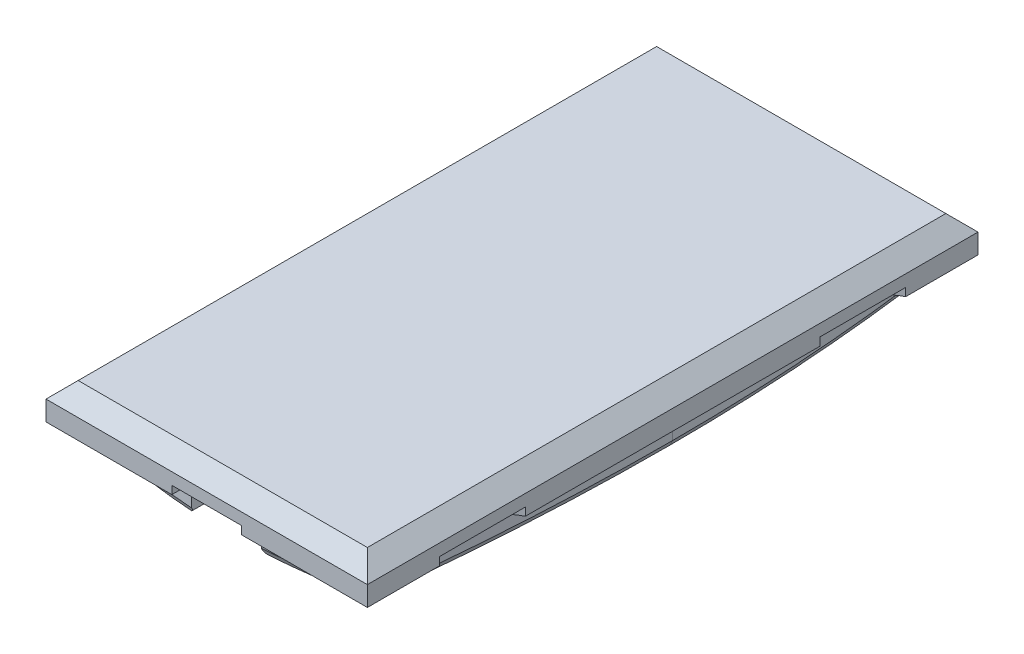
from build123d import *
from OCP.BRepFilletAPI import BRepFilletAPI_MakeChamfer

# Parameters (mm, degrees)
SKETCH1_W           = 60
SKETCH1_H           = 114
BOSS_EXTRUDE1_DEPTH = 11.7
CHAMFER1_SIZE       = 3
SKETCH2_W           = 60
SKETCH2_H           = 114
CUT_EXTRUDE1_DEPTH  = 5
SKETCH3_W           = 13
SKETCH3_H           = 18
CUT_EXTRUDE2_DEPTH  = 1.5
SKETCH4_W           = 45
SKETCH4_H           = 61
CUT_EXTRUDE3_DEPTH  = 3
SKETCH5_W           = 38
SKETCH5_H           = 40
CUT_EXTRUDE4_DEPTH  = 3
FILLET1_R           = 3.5
FILLET2_R           = 2.5
FILLET3_R           = 2
CHAMFER2_SIZE       = 1
CHAMFER2_SIZE2      = 0.5
CHAMFER3_SIZE       = 0.5
SKETCH6_R           = 1.5
CUT_EXTRUDE5_DEPTH  = 3.5
CUT_EXTRUDE6_DEPTH  = 1.5


with BuildPart() as part:
    # Sketch1 → Boss-Extrude1 (new body)
    with BuildSketch(Plane(origin=(0, 0, 0), x_dir=(1, 0, 0), z_dir=(0, 1, 0))):
        with Locations((-10.45158014, -23.74642162)):
            Rectangle(SKETCH1_W, SKETCH1_H)
    extrude(amount=BOSS_EXTRUDE1_DEPTH)

    # Chamfer1
    chamfer1_edges = [part.edges().sort_by_distance(p)[0] for p in [
        (19.54841986, 11.7, 23.74642162),
        (-10.45158014, 11.7, -33.25357838),
        (-40.45158014, 11.7, 23.74642162),
        (-10.45158014, 11.7, 80.74642162),
    ]]
    chamfer(chamfer1_edges, length=CHAMFER1_SIZE)

    # Sketch2 → Cut-Extrude1 (cut)
    with BuildSketch(Plane.XZ):
        with Locations((-10.45158014, 23.74642162)):
            Rectangle(SKETCH2_W, SKETCH2_H)
        with BuildLine():
            Line((-16.95158014, 66.74642162), (-32.95158014, 66.74642162))
            Line((-32.95158014, 66.74642162), (-32.95158014, 62.076548639))
            ThreePointArc((-32.95158014, 62.076548639), (-35.45158014, 57.74642162), (-32.95158014, 53.416294601))
            Line((-32.95158014, 53.416294601), (-32.95158014, -6.923451361))
            ThreePointArc((-32.95158014, -6.923451361), (-35.45158014, -11.25357838), (-32.95158014, -15.583705399))
            Line((-32.95158014, -15.583705399), (-32.95158014, -27.423217898))
            ThreePointArc((-32.95158014, -27.423217898), (-33.877440516, -27.225181452), (-34.801558591, -27.019167732))
            ThreePointArc((-34.801558591, -27.019167732), (-37.95158014, 23.74642162), (-34.801558591, 74.512010973))
            ThreePointArc((-34.801558591, 74.512010973), (-25.928837863, 76.149977985), (-16.95158014, 77.053832398))
            Line((-16.95158014, 77.053832398), (-16.95158014, 66.74642162))
        make_face(mode=Mode.SUBTRACT)
        with BuildLine():
            Line((12.04841986, -27.423217898), (12.04841986, -15.583705399))
            ThreePointArc((12.04841986, -15.583705399), (14.54841986, -11.25357838), (12.04841986, -6.923451361))
            Line((12.04841986, -6.923451361), (12.04841986, 53.416294601))
            ThreePointArc((12.04841986, 53.416294601), (14.54841986, 57.74642162), (12.04841986, 62.076548639))
            Line((12.04841986, 62.076548639), (12.04841986, 66.74642162))
            Line((12.04841986, 66.74642162), (-3.95158014, 66.74642162))
            Line((-3.95158014, 66.74642162), (-3.95158014, 77.053832398))
            ThreePointArc((-3.95158014, 77.053832398), (5.017673336, 76.151117483), (13.882630885, 74.515596223))
            ThreePointArc((13.882630885, 74.515596223), (16.256275014, 47.928003202), (17.04841986, 21.24642162))
            ThreePointArc((17.04841986, 21.24642162), (16.264424292, -2.93518383), (13.915730454, -27.015223873))
            ThreePointArc((13.915730454, -27.015223873), (12.982963068, -27.223284684), (12.04841986, -27.423217898))
        make_face(mode=Mode.SUBTRACT)
    extrude(amount=-CUT_EXTRUDE1_DEPTH, mode=Mode.SUBTRACT)

    # Sketch3 → Cut-Extrude2 (cut)
    with BuildSketch(Plane.XZ.offset(-5)):
        with Locations((-10.45158014, 71.74642162)):
            Rectangle(SKETCH3_W, SKETCH3_H)
    extrude(amount=-CUT_EXTRUDE2_DEPTH, mode=Mode.SUBTRACT)

    # Sketch4 → Cut-Extrude3 (cut)
    with BuildSketch(Plane.XZ.offset(-5)):
        with Locations((-10.45158014, 1.24642162)):
            Rectangle(SKETCH4_W, SKETCH4_H)
    extrude(amount=-CUT_EXTRUDE3_DEPTH, mode=Mode.SUBTRACT)

    # Sketch5 → Cut-Extrude4 (cut)
    with BuildSketch(Plane.XZ.offset(-8)):
        with Locations((-10.45158014, -9.25357838)):
            Rectangle(SKETCH5_W, SKETCH5_H)
    extrude(amount=-CUT_EXTRUDE4_DEPTH, mode=Mode.SUBTRACT)

    # Fillet1
    # the kernel refuses this fillet: 3.5 mm, written as the material it adds along each edge
    with BuildSketch(Plane(origin=(-32.95158014, -3.75, -29.25357838), x_dir=(0, 0, 1), z_dir=(0, 1, 0))) as fillet1_piece_1_section:
        with BuildLine():
            CenterArc((FILLET1_R, FILLET1_R), FILLET1_R, 180, 90)
            Line((0, FILLET1_R), (0, 0))
            Line((0, 0), (FILLET1_R, 0))
        make_face()
    fillet1_piece_1 = extrude(amount=20.5, mode=Mode.PRIVATE)
    fillet1_piece_1 = fillet1_piece_1 & Plane(origin=(-10.45158014, 2.5, 80.032135907), x_dir=(-0.20494469746262578, 0, -0.9787735544966225), z_dir=(0, -1, 0)) * Cylinder(109.785714286, 56, mode=Mode.PRIVATE)
    fillet1_piece_1 = split(fillet1_piece_1, bisect_by=Plane(origin=(-32.811117147, 0, -27.048501242), z_dir=(0, 1, 0)), keep=Keep.TOP, mode=Mode.PRIVATE)
    fillet1_piece_1 = split(fillet1_piece_1, bisect_by=Plane(origin=(-32.811117147, 11, -27.048501242), z_dir=(0, -1, 0)), keep=Keep.TOP, mode=Mode.PRIVATE)
    add(fillet1_piece_1)
    with BuildSketch(Plane(origin=(-32.95158014, 5, -29.25357838), x_dir=(0, 0, 1), z_dir=(0, 1, 0))) as fillet1_piece_2_section:
        with BuildLine():
            CenterArc((FILLET1_R, FILLET1_R), FILLET1_R, 180, 90)
            Line((0, FILLET1_R), (0, 0))
            Line((0, 0), (FILLET1_R, 0))
        make_face()
    fillet1_piece_2 = extrude(amount=11.75, mode=Mode.PRIVATE)
    fillet1_piece_2 = split(fillet1_piece_2, bisect_by=Plane(origin=(-32.102090835, 11, -28.622040282), z_dir=(0, -1, 0)), keep=Keep.TOP, mode=Mode.PRIVATE)
    add(fillet1_piece_2)
    with BuildSketch(Plane(origin=(-32.95158014, 5, 31.74642162), x_dir=(0, 0, -1), z_dir=(0, 1, 0)), Plane(origin=(-29.45158014, 8, -29.25357838), x_dir=(1, 0, 0), z_dir=(0, 1, 0))) as fillet1_piece_3:
        with BuildLine():
            CenterArc((FILLET1_R, -FILLET1_R), FILLET1_R, 90, 90)
            Line((0, -FILLET1_R), (0, 0))
            Line((0, 0), (FILLET1_R, 0))
        make_face()
    extrude(amount=3)
    with BuildSketch(Plane(origin=(12.04841986, 5, 31.74642162), x_dir=(0, 0, -1), z_dir=(0, 1, 0)), Plane(origin=(8.54841986, 8, -29.25357838), x_dir=(-1, 0, 0), z_dir=(0, 1, 0)), Plane(origin=(-29.45158014, 8, 10.74642162), x_dir=(1, 0, 0), z_dir=(0, 1, 0)), Plane(origin=(8.54841986, 8, 10.74642162), x_dir=(0, 0, -1), z_dir=(0, 1, 0))) as fillet1_piece_4:
        with BuildLine():
            CenterArc((FILLET1_R, FILLET1_R), FILLET1_R, 180, 90)
            Line((0, FILLET1_R), (0, 0))
            Line((0, 0), (FILLET1_R, 0))
        make_face()
    extrude(amount=3)
    with BuildSketch(Plane(origin=(12.04841986, -3.75, -29.25357838), x_dir=(-1, 0, 0), z_dir=(0, 1, 0))) as fillet1_piece_5_section:
        with BuildLine():
            CenterArc((FILLET1_R, FILLET1_R), FILLET1_R, 180, 90)
            Line((0, FILLET1_R), (0, 0))
            Line((0, 0), (FILLET1_R, 0))
        make_face()
    fillet1_piece_5 = extrude(amount=20.5, mode=Mode.PRIVATE)
    fillet1_piece_5 = fillet1_piece_5 & Plane(origin=(-10.45158014, 2.5, 80.032135907), x_dir=(0.2219533821184848, 0, -0.9750572784027438), z_dir=(0, -1, 0)) * Cylinder(109.785714286, 56, mode=Mode.PRIVATE)
    fillet1_piece_5 = split(fillet1_piece_5, bisect_by=Plane(origin=(11.907956868, 0, -27.048501242), z_dir=(0, 1, 0)), keep=Keep.TOP, mode=Mode.PRIVATE)
    fillet1_piece_5 = split(fillet1_piece_5, bisect_by=Plane(origin=(11.907956868, 11, -27.048501242), z_dir=(0, -1, 0)), keep=Keep.TOP, mode=Mode.PRIVATE)
    add(fillet1_piece_5)
    with BuildSketch(Plane(origin=(12.04841986, 5, -29.25357838), x_dir=(-1, 0, 0), z_dir=(0, 1, 0))) as fillet1_piece_6_section:
        with BuildLine():
            CenterArc((FILLET1_R, FILLET1_R), FILLET1_R, 180, 90)
            Line((0, FILLET1_R), (0, 0))
            Line((0, 0), (FILLET1_R, 0))
        make_face()
    fillet1_piece_6 = extrude(amount=11.75, mode=Mode.PRIVATE)
    fillet1_piece_6 = split(fillet1_piece_6, bisect_by=Plane(origin=(11.198930555, 11, -28.622040282), z_dir=(0, -1, 0)), keep=Keep.TOP, mode=Mode.PRIVATE)
    add(fillet1_piece_6)
    with BuildSketch(Plane(origin=(-32.95158014, 0, 66.74642162), x_dir=(1, 0, 0), z_dir=(0, 1, 0))) as fillet1_piece_7:
        with BuildLine():
            CenterArc((FILLET1_R, FILLET1_R), FILLET1_R, 180, 90)
            Line((0, FILLET1_R), (0, 0))
            Line((0, 0), (FILLET1_R, 0))
        make_face()
    extrude(amount=5)
    with BuildSketch(Plane(origin=(12.04841986, 0, 66.74642162), x_dir=(-1, 0, 0), z_dir=(0, 1, 0))) as fillet1_piece_8:
        with BuildLine():
            CenterArc((FILLET1_R, -FILLET1_R), FILLET1_R, 90, 90)
            Line((0, -FILLET1_R), (0, 0))
            Line((0, 0), (FILLET1_R, 0))
        make_face()
    extrude(amount=5)

    # Fillet2
    fillet2_edges = [part.edges().sort_by_distance(p)[0] for p in [
        (-3.95158014, 5.75, 62.74642162),
        (-16.95158014, 5.75, 62.74642162),
    ]]
    fillet(fillet2_edges, radius=FILLET2_R)

    # Fillet3
    fillet3_edges = [part.edges().sort_by_distance(p)[0] for p in [
        (-34.801558591, 2.5, 74.512010973),
        (-34.801558591, 2.5, -27.019167732),
        (13.915730454, 2.5, -27.015223873),
        (13.882630885, 2.5, 74.515596223),
    ]]
    fillet(fillet3_edges, radius=FILLET3_R)

    # Chamfer2: one chamfer whose edges measure the first distance from different faces: ONE call of the kernel's chamfer builder (chamfer() names one face for all edges)
    chamfer2_edges_1 = [part.edges().sort_by_distance(p)[0] for p in [
        (-37.95158014, 0, 23.74642162),
    ]]
    chamfer2_side_1 = [part.faces().sort_by_distance(p)[0] for p in [
        (-37.95158014, 2.5, 23.74642162),
    ]]
    chamfer2_edges_2 = [part.edges().sort_by_distance(p)[0] for p in [
        (-34.465476537, 0, -26.720070087),
    ]]
    chamfer2_side_2 = [part.faces().sort_by_distance(p)[0] for p in [
        (-34.465476537, 2.5, -26.720070087),
    ]]
    chamfer2_edges_3 = [part.edges().sort_by_distance(p)[0] for p in [
        (-34.465476537, 0, 74.212913327),
    ]]
    chamfer2_side_3 = [part.faces().sort_by_distance(p)[0] for p in [
        (-34.465476537, 2.5, 74.212913327),
    ]]
    chamfer2_edges_4 = [part.edges().sort_by_distance(p)[0] for p in [
        (4.306544215, 0, 76.249956926),
    ]]
    chamfer2_side_4 = [part.faces().sort_by_distance(p)[0] for p in [
        (4.306544215, 2.5, 76.249956926),
    ]]
    chamfer2_edges_5 = [part.edges().sort_by_distance(p)[0] for p in [
        (13.58423868, 0, -26.718423322),
    ]]
    chamfer2_side_5 = [part.faces().sort_by_distance(p)[0] for p in [
        (13.58423868, 2.5, -26.718423322),
    ]]
    chamfer2_edges_6 = [part.edges().sort_by_distance(p)[0] for p in [
        (13.54230268, 0, 74.214382771),
    ]]
    chamfer2_side_6 = [part.faces().sort_by_distance(p)[0] for p in [
        (13.54230268, 2.5, 74.214382771),
    ]]
    chamfer2_edges_7 = [part.edges().sort_by_distance(p)[0] for p in [
        (-25.221672551, 0, 76.248332694),
    ]]
    chamfer2_side_7 = [part.faces().sort_by_distance(p)[0] for p in [
        (-25.221672551, 2.5, 76.248332694),
    ]]
    chamfer2_edges_8 = [part.edges().sort_by_distance(p)[0] for p in [
        (12.049376841, 0, -27.423017512),
    ]]
    chamfer2_side_8 = [part.faces().sort_by_distance(p)[0] for p in [
        (12.049376841, 2.5, -27.423017512),
    ]]
    chamfer2_edges_9 = [part.edges().sort_by_distance(p)[0] for p in [
        (16.298008586, 0, 47.216246873),
    ]]
    chamfer2_side_9 = [part.faces().sort_by_distance(p)[0] for p in [
        (16.298008586, 2.5, 47.216246873),
    ]]
    chamfer2_edges_10 = [part.edges().sort_by_distance(p)[0] for p in [
        (16.309427763, 0, -2.231590681),
    ]]
    chamfer2_side_10 = [part.faces().sort_by_distance(p)[0] for p in [
        (16.309427763, 2.5, -2.231590681),
    ]]
    chamfer2_edges_11 = [part.edges().sort_by_distance(p)[0] for p in [
        (-32.939594534, 0, -27.425726858),
    ]]
    chamfer2_side_11 = [part.faces().sort_by_distance(p)[0] for p in [
        (-32.939594534, 2.5, -27.425726858),
    ]]
    chamfer2 = BRepFilletAPI_MakeChamfer(part.part.solid().wrapped)
    for e in chamfer2_edges_1:
        chamfer2.Add(CHAMFER2_SIZE, CHAMFER2_SIZE2, e.wrapped, chamfer2_side_1[0].wrapped)  # the first distance lies on this face
    for e in chamfer2_edges_2:
        chamfer2.Add(CHAMFER2_SIZE, CHAMFER2_SIZE2, e.wrapped, chamfer2_side_2[0].wrapped)  # the first distance lies on this face
    for e in chamfer2_edges_3:
        chamfer2.Add(CHAMFER2_SIZE, CHAMFER2_SIZE2, e.wrapped, chamfer2_side_3[0].wrapped)  # the first distance lies on this face
    for e in chamfer2_edges_4:
        chamfer2.Add(CHAMFER2_SIZE, CHAMFER2_SIZE2, e.wrapped, chamfer2_side_4[0].wrapped)  # the first distance lies on this face
    for e in chamfer2_edges_5:
        chamfer2.Add(CHAMFER2_SIZE, CHAMFER2_SIZE2, e.wrapped, chamfer2_side_5[0].wrapped)  # the first distance lies on this face
    for e in chamfer2_edges_6:
        chamfer2.Add(CHAMFER2_SIZE, CHAMFER2_SIZE2, e.wrapped, chamfer2_side_6[0].wrapped)  # the first distance lies on this face
    for e in chamfer2_edges_7:
        chamfer2.Add(CHAMFER2_SIZE, CHAMFER2_SIZE2, e.wrapped, chamfer2_side_7[0].wrapped)  # the first distance lies on this face
    for e in chamfer2_edges_8:
        chamfer2.Add(CHAMFER2_SIZE, CHAMFER2_SIZE2, e.wrapped, chamfer2_side_8[0].wrapped)  # the first distance lies on this face
    for e in chamfer2_edges_9:
        chamfer2.Add(CHAMFER2_SIZE, CHAMFER2_SIZE2, e.wrapped, chamfer2_side_9[0].wrapped)  # the first distance lies on this face
    for e in chamfer2_edges_10:
        chamfer2.Add(CHAMFER2_SIZE, CHAMFER2_SIZE2, e.wrapped, chamfer2_side_10[0].wrapped)  # the first distance lies on this face
    for e in chamfer2_edges_11:
        chamfer2.Add(CHAMFER2_SIZE, CHAMFER2_SIZE2, e.wrapped, chamfer2_side_11[0].wrapped)  # the first distance lies on this face
    add(Compound.cast(chamfer2.Shape()), mode=Mode.REPLACE)

    # Chamfer3
    # the kernel refuses this chamfer: 0.5 mm, written as the material it takes off along each edge
    with BuildSketch(Plane(origin=(8.54841986, 0, -25.75357838), x_dir=(0.7528681721183149, 0, -0.6581713419856772), z_dir=(-0.6581713419856772, 0, -0.7528681721183149))) as chamfer3_piece_1:
        Polygon((3.5, -CHAMFER3_SIZE), (3.5 + CHAMFER3_SIZE, 0), (3.5, 0), align=None)
    revolve(axis=Axis((8.54841986, 0, -25.75357838), (0, -1, 0)), revolution_arc=41.16055761, mode=Mode.SUBTRACT)
    with BuildSketch(Plane(origin=(12.04841986, 0, -25.75357838), x_dir=(0.9996219169112968, -0.02749587661058639, 0), z_dir=(0, 0, 1)), Plane(origin=(-32.95158014, 0, -14.297863905), x_dir=(-0.9996219169112968, -0.027495876610586483, 0), z_dir=(0, 0, -1))) as chamfer3_piece_2:
        Polygon((CHAMFER3_SIZE * 0.999621916911, CHAMFER3_SIZE * 0.0274958766106), (-CHAMFER3_SIZE * 0.0274958766106, CHAMFER3_SIZE * 0.999621916911), (0, 0), align=None)
    extrude(amount=11.455714475, mode=Mode.SUBTRACT)
    with BuildSketch(Plane(origin=(9.54841986, 0, -11.25357838), x_dir=(0.26311232273266166, 0, -0.9647652075122857), z_dir=(-0.9647652075122857, 0, -0.26311232273266166))) as chamfer3_piece_3:
        Polygon((5 + CHAMFER3_SIZE, 0), (5, -CHAMFER3_SIZE), (5, 0), align=None)
    revolve(axis=Axis((9.54841986, 0, -11.25357838), (0, -1, 0)), revolution_arc=149.490366343, mode=Mode.SUBTRACT)
    with BuildSketch(Plane(origin=(12.04841986, 0, -8.209292855), x_dir=(0.9996219169112968, -0.02749587661058639, 0), z_dir=(0, 0, 1)), Plane(origin=(-32.95158014, 0, 54.702136095), x_dir=(-0.9996219169112968, -0.027495876610586483, 0), z_dir=(0, 0, -1))) as chamfer3_piece_4:
        Polygon((CHAMFER3_SIZE * 0.999621916911, CHAMFER3_SIZE * 0.0274958766106), (-CHAMFER3_SIZE * 0.0274958766106, CHAMFER3_SIZE * 0.999621916911), (0, 0), align=None)
    extrude(amount=62.91142895, mode=Mode.SUBTRACT)
    with BuildSketch(Plane(origin=(9.54841986, 0, 57.74642162), x_dir=(0.26311232273265706, 0, -0.964765207512287), z_dir=(-0.964765207512287, 0, -0.26311232273265706))) as chamfer3_piece_5:
        Polygon((5 + CHAMFER3_SIZE, 0), (5, -CHAMFER3_SIZE), (5, 0), align=None)
    revolve(axis=Axis((9.54841986, 0, 57.74642162), (0, -1, 0)), revolution_arc=149.490366343, mode=Mode.SUBTRACT)
    with BuildSketch(Plane(origin=(12.04841986, 0, 60.790707145), x_dir=(0.9996219169112968, -0.02749587661058639, 0), z_dir=(0, 0, 1)), Plane(origin=(-32.95158014, 0, 63.24642162), x_dir=(-0.9996219169112968, -0.027495876610586483, 0), z_dir=(0, 0, -1))) as chamfer3_piece_6:
        Polygon((CHAMFER3_SIZE * 0.999621916911, CHAMFER3_SIZE * 0.0274958766106), (-CHAMFER3_SIZE * 0.0274958766106, CHAMFER3_SIZE * 0.999621916911), (0, 0), align=None)
    extrude(amount=2.455714475, mode=Mode.SUBTRACT)
    with BuildSketch(Plane(origin=(8.54841986, 0, 63.24642162), x_dir=(0, 0, 1), z_dir=(-1, 0, 0))) as chamfer3_piece_7:
        Polygon((3.5 + CHAMFER3_SIZE, 0), (3.5, CHAMFER3_SIZE), (3.5, 0), align=None)
    revolve(axis=Axis((8.54841986, 0, 63.24642162), (0, 1, 0)), revolution_arc=90, mode=Mode.SUBTRACT)
    with BuildSketch(Plane(origin=(8.54841986, 0, 66.74642162), x_dir=(0, -0.027495876610586483, 0.9996219169112968), z_dir=(-1, 0, 0)), Plane(origin=(-15.665738646, 0, 66.74642162), x_dir=(0, -0.027495876610586483, 0.9996219169112968), z_dir=(-1, 0, 0))) as chamfer3_piece_8:
        Polygon((CHAMFER3_SIZE * 0.999621916911, CHAMFER3_SIZE * 0.0274958766106), (-CHAMFER3_SIZE * 0.0274958766106, CHAMFER3_SIZE * 0.999621916911), (0, 0), align=None)
    extrude(amount=13.785841494, mode=Mode.SUBTRACT)
    with BuildSketch(Plane(origin=(-3.95158014, 0, 65.460580126), x_dir=(0.9996219169112968, -0.027495876610586344, 0), z_dir=(0, 0, 1))) as chamfer3_piece_9:
        Polygon((CHAMFER3_SIZE * 0.999621916911, CHAMFER3_SIZE * 0.0274958766106), (-CHAMFER3_SIZE * 0.0274958766106, CHAMFER3_SIZE * 0.999621916911), (0, 0), align=None)
    extrude(amount=12.37821108, mode=Mode.SUBTRACT)
    with BuildSketch(Plane(origin=(-16.95158014, 0, 77.838791206), x_dir=(0.02749587661058908, 0.9996219169112968, 0), z_dir=(0, 0, -1))) as chamfer3_piece_10:
        Polygon((CHAMFER3_SIZE * 0.999621916911, -CHAMFER3_SIZE * 0.0274958766106), (-CHAMFER3_SIZE * 0.0274958766106, -CHAMFER3_SIZE * 0.999621916911), (0, 0), align=None)
    extrude(amount=12.37821108, mode=Mode.SUBTRACT)
    with BuildSketch(Plane(origin=(-29.45158014, 0, 63.24642162), x_dir=(-1, 0, 0), z_dir=(0, 0, -1))) as chamfer3_piece_11:
        Polygon((3.5 + CHAMFER3_SIZE, 0), (3.5, CHAMFER3_SIZE), (3.5, 0), align=None)
    revolve(axis=Axis((-29.45158014, 0, 63.24642162), (0, 1, 0)), revolution_arc=90, mode=Mode.SUBTRACT)
    with BuildSketch(Plane(origin=(-29.45158014, 0, -25.75357838), x_dir=(-1, 0, 0), z_dir=(0, 0, 1))) as chamfer3_piece_12:
        Polygon((3.5, -CHAMFER3_SIZE), (3.5 + CHAMFER3_SIZE, 0), (3.5, 0), align=None)
    revolve(axis=Axis((-29.45158014, 0, -25.75357838), (0, -1, 0)), revolution_arc=41.16055761, mode=Mode.SUBTRACT)
    with BuildSketch(Plane(origin=(-30.45158014, 0, 57.74642162), x_dir=(-0.2631123227326664, 0, 0.9647652075122846), z_dir=(0.9647652075122846, 0, 0.2631123227326664))) as chamfer3_piece_13:
        Polygon((5 + CHAMFER3_SIZE, 0), (5, -CHAMFER3_SIZE), (5, 0), align=None)
    revolve(axis=Axis((-30.45158014, 0, 57.74642162), (0, -1, 0)), revolution_arc=149.490366343, mode=Mode.SUBTRACT)
    with BuildSketch(Plane(origin=(-30.45158014, 0, -11.25357838), x_dir=(-0.26311232273266216, 0, 0.9647652075122856), z_dir=(0.9647652075122856, 0, 0.26311232273266216))) as chamfer3_piece_14:
        Polygon((5 + CHAMFER3_SIZE, 0), (5, -CHAMFER3_SIZE), (5, 0), align=None)
    revolve(axis=Axis((-30.45158014, 0, -11.25357838), (0, -1, 0)), revolution_arc=149.490366343, mode=Mode.SUBTRACT)

    # Sketch6 → Cut-Extrude5 (cut)
    with BuildSketch(Plane.XZ.offset(-5)):
        with Locations(Location((-37.45158014, -29.25357838, 0), (0, 0, 270))):
            Circle(SKETCH6_R)
        with Locations(Location((16.54841986, -29.25357838, 0), (0, 0, 270))):
            Circle(SKETCH6_R)
        with Locations(Location((16.54841986, 76.74642162, 0), (0, 0, 270))):
            Circle(SKETCH6_R)
        with Locations(Location((-37.45158014, 76.74642162, 0), (0, 0, 270))):
            Circle(SKETCH6_R)
    extrude(amount=-CUT_EXTRUDE5_DEPTH, mode=Mode.SUBTRACT)

    # Sketch7 → Cut-Extrude6 (cut)
    with BuildSketch(Plane.XZ.offset(-5)):
        with BuildLine():
            Line((19.54841986, -19.75357838), (19.54841986, -3.75357838))
            ThreePointArc((19.54841986, -3.75357838), (14.54841986, -11.75357838), (19.54841986, -19.75357838))
        make_face()
        with BuildLine():
            Line((19.54841986, 51.24642162), (19.54841986, 67.24642162))
            ThreePointArc((19.54841986, 67.24642162), (14.54841986, 59.24642162), (19.54841986, 51.24642162))
        make_face()
        with BuildLine():
            Line((-40.45158014, -19.75357838), (-40.45158014, -3.75357838))
            ThreePointArc((-40.45158014, -3.75357838), (-35.45158014, -11.75357838), (-40.45158014, -19.75357838))
        make_face()
        with BuildLine():
            Line((-40.45158014, 51.24642162), (-40.45158014, 67.24642162))
            ThreePointArc((-40.45158014, 67.24642162), (-35.45158014, 59.24642162), (-40.45158014, 51.24642162))
        make_face()
    extrude(amount=-CUT_EXTRUDE6_DEPTH, mode=Mode.SUBTRACT)


solid = part.part
